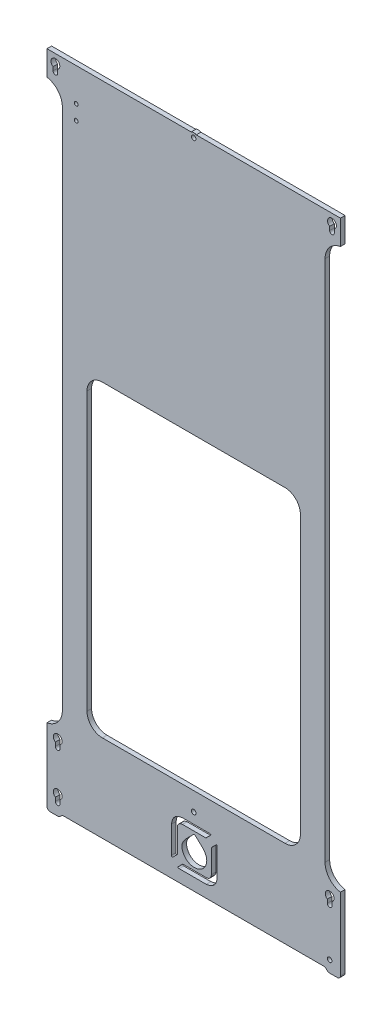
from build123d import *

# Parameters (mm, degrees)
SKETCH1_R           = 1.5
BOSS_EXTRUDE1_DEPTH = 3
SKETCH2_W           = 10
SKETCH2_H           = 363
CUT_EXTRUDE1_DEPTH  = 401.99329533
FILLET1_R           = 12
SKETCH3_R           = 1.5
CUT_EXTRUDE2_DEPTH  = 401.99329533
SKETCH4_W           = 138.54
SKETCH4_H           = 200
CUT_EXTRUDE3_DEPTH  = 401.99329533
FILLET2_R           = 10
CUT_EXTRUDE6_DEPTH  = 401.99329533
BOSS_EXTRUDE2_DEPTH = 3
SKETCH9_R           = 1.25
CUT_EXTRUDE7_DEPTH  = 402.478982012
FILLET3_R           = 2


with BuildPart() as part:
    # Sketch1 → Boss-Extrude1 (new body)
    with BuildSketch(Plane.XY):
        Polygon((95.27, 389.5), (-95.27, 389.5), (-95.27, -36.5), (-95.27, -38.5), (-87.27, -38.5), (-85.27, -36.5), (85.27, -36.5), (87.27, -38.5), (95.27, -38.5), (95.27, -36.5), align=None)
        with Locations((88.27, -31)):
            Circle(SKETCH1_R, mode=Mode.SUBTRACT)
        with BuildLine():
            Line((-89.77, -31), (-89.77, -28.576675837))
            ThreePointArc((-89.77, -28.576675837), (-88.27, -23.303351674), (-86.77, -28.576675837))
            Line((-86.77, -28.576675837), (-86.77, -31))
            ThreePointArc((-86.77, -31), (-88.27, -32.5), (-89.77, -31))
        make_face(mode=Mode.SUBTRACT)
        with BuildLine():
            Line((-91.27, 379), (-91.27, 381.423324163))
            ThreePointArc((-91.27, 381.423324163), (-89.77, 386.696648326), (-88.27, 381.423324163))
            Line((-88.27, 381.423324163), (-88.27, 379))
            ThreePointArc((-88.27, 379), (-89.77, 377.5), (-91.27, 379))
        make_face(mode=Mode.SUBTRACT)
        with BuildLine():
            Line((-89.77, 0), (-89.77, 2.423324163))
            ThreePointArc((-89.77, 2.423324163), (-88.27, 7.696648326), (-86.77, 2.423324163))
            Line((-86.77, 2.423324163), (-86.77, 0))
            ThreePointArc((-86.77, 0), (-88.27, -1.5), (-89.77, 0))
        make_face(mode=Mode.SUBTRACT)
        with BuildLine():
            Line((86.77, 0), (86.77, 2.423324163))
            ThreePointArc((86.77, 2.423324163), (88.27, 7.696648326), (89.77, 2.423324163))
            Line((89.77, 2.423324163), (89.77, 0))
            ThreePointArc((89.77, 0), (88.27, -1.5), (86.77, 0))
        make_face(mode=Mode.SUBTRACT)
        with BuildLine():
            Line((88.27, 379), (88.27, 381.423324163))
            ThreePointArc((88.27, 381.423324163), (89.77, 386.696648326), (91.27, 381.423324163))
            Line((91.27, 381.423324163), (91.27, 379))
            ThreePointArc((91.27, 379), (89.77, 377.5), (88.27, 379))
        make_face(mode=Mode.SUBTRACT)
    extrude(amount=BOSS_EXTRUDE1_DEPTH)

    # Sketch2 → Cut-Extrude1 (cut, through all)
    with BuildSketch(Plane.XY.offset(3)):
        with Locations((-90.27, 192)):
            Rectangle(SKETCH2_W, SKETCH2_H)
        with Locations((90.27, 192)):
            Rectangle(SKETCH2_W, SKETCH2_H)
    extrude(amount=-CUT_EXTRUDE1_DEPTH, mode=Mode.SUBTRACT)

    # Fillet1
    # the kernel refuses this fillet: 12 mm, written as the material it adds along each edge
    with BuildSketch(Plane(origin=(85.27, 10.5, 3), x_dir=(0, 1, 0), z_dir=(0, 0, -1))) as fillet1_piece_1:
        with BuildLine():
            CenterArc((11.832159566, 12), FILLET1_R, 189.594068227, 80.405931773)
            Line((0, 10), (-0.236643191, 9.96))
            ThreePointArc((-0.236643191, 9.96), (-0.24, 5), (-0.24, 0))
            Line((-0.24, 0), (0, -0.24))
            Line((0, -0.24), (11.832159566, -0.24))
            Line((11.832159566, -0.24), (11.832159566, 0))
        make_face()
    extrude(amount=3)
    with BuildSketch(Plane(origin=(-85.27, 10.5, 3), x_dir=(-1, 0, 0), z_dir=(0, 0, -1)), Plane(origin=(85.27, 373.5, 3), x_dir=(1, 0, 0), z_dir=(0, 0, -1))) as fillet1_piece_2:
        with BuildLine():
            CenterArc((12, 11.832159566), FILLET1_R, 180, 80.405931773)
            Line((0, 11.832159566), (-0.24, 11.832159566))
            Line((-0.24, 11.832159566), (-0.24, 0))
            Line((-0.24, 0), (0, -0.24))
            ThreePointArc((0, -0.24), (5, -0.24), (9.96, -0.236643191))
            Line((9.96, -0.236643191), (10, 0))
        make_face()
    extrude(amount=3)
    with BuildSketch(Plane(origin=(-85.27, 373.5, 3), x_dir=(-1, 0, 0), z_dir=(0, 0, -1))) as fillet1_piece_3:
        with BuildLine():
            CenterArc((12, -11.832159566), FILLET1_R, 99.594068227, 80.405931773)
            Line((0, -11.832159566), (-0.24, -11.832159566))
            Line((-0.24, -11.832159566), (-0.24, 0))
            Line((-0.24, 0), (0, 0.24))
            ThreePointArc((0, 0.24), (5, 0.24), (9.96, 0.236643191))
            Line((9.96, 0.236643191), (10, 0))
        make_face()
    extrude(amount=3)

    # Sketch3 → Cut-Extrude2 (cut, through all)
    with BuildSketch(Plane.XY.offset(3)):
        with Locations((0, 8)):
            Circle(SKETCH3_R)
        with Locations((0, 387)):
            Circle(SKETCH3_R)
    extrude(amount=-CUT_EXTRUDE2_DEPTH, mode=Mode.SUBTRACT)

    # Sketch4 → Cut-Extrude3 (cut, through all)
    with BuildSketch(Plane.XY.offset(3)):
        with Locations((0, 120)):
            Rectangle(SKETCH4_W, SKETCH4_H)
    extrude(amount=-CUT_EXTRUDE3_DEPTH, mode=Mode.SUBTRACT)

    # Fillet2
    fillet2_edges = [part.edges().sort_by_distance(p)[0] for p in [
        (69.27, 220, 1.5),
        (69.27, 20, 1.5),
        (-69.27, 20, 1.5),
        (-69.27, 220, 1.5),
    ]]
    fillet(fillet2_edges, radius=FILLET2_R)

    # Sketch7 → Cut-Extrude6 (cut, through all)
    with BuildSketch(Plane.XY.offset(3)):
        with BuildLine():
            Line((0, -4.625747067), (-4.853446, -9.478911067))
            add(Edge.make_bspline(
                [(-4.853446, -9.478911067), (-4.857912351, -9.483081634), (-4.866656945, -9.491247116), (-4.879059302, -9.503713001), (-5.337538841, -10.010036555), (-6.230966435, -11.055373417), (-7.331192138, -12.859816706), (-7.888732766, -15.68247692), (-6.848251753, -19.219926816), (-3.87827619, -22.168921175), (0.257731389, -23.442729161), (4.556872717, -22.384536362), (7.711761661, -19.214884535), (8.721669996, -15.693361765), (8.210921716, -12.898452929), (7.297062, -11.024788806), (6.42340495, -9.982340385), (6.00149, -9.478911067)],
                knots=[0, 0, 0, 0, 0.00048905, 0.000957504, 0.001406767, 0.055150507, 0.111017642, 0.168412939, 0.28062072, 0.389776696, 0.490762396, 0.614386559, 0.723193993, 0.835330316, 0.891393178, 0.947550538, 1, 1, 1, 1], degree=3))
            Line((6.00149, -9.478911067), (0.85164, -4.625747067))
            add(Edge.make_bspline(
                [(0.85164, -4.625747067), (0.812504777, -4.591871198), (0.735157355, -4.524918441), (0.595429053, -4.455653648), (0.494352228, -4.445831945), (0.443865, -4.440926067)],
                knots=[0, 0, 0, 0, 0.338885039, 0.6697773, 1, 1, 1, 1], degree=3))
            add(Edge.make_bspline(
                [(0.443865, -4.440926067), (0.391231255, -4.446012435), (0.28283653, -4.456487378), (0.128603807, -4.520285983), (0.042643095, -4.590777752), (0, -4.625747067)],
                knots=[0, 0, 0, 0, 0.322338023, 0.663827768, 1, 1, 1, 1], degree=3))
        make_face()
        with BuildLine():
            Line((-7.262249, -2.659011067), (7.816498, -2.659011067))
            add(Edge.make_bspline(
                [(7.816498, -2.659011067), (7.838633855, -2.657336087), (7.882028547, -2.65405249), (7.947196989, -2.646372498), (7.996383548, -2.620362599), (8.032363529, -2.594906582), (8.055666343, -2.571516128), (8.069966408, -2.556399534), (8.076952, -2.549015067)],
                knots=[0, 0, 0, 0, 0.227492727, 0.445972237, 0.663373124, 0.787115425, 0.896005733, 1, 1, 1, 1], degree=3))
            Line((8.076952, -2.549015067), (11.003915, 0.378054933))
            add(Edge.make_bspline(
                [(11.003915, 0.378054933), (11.032885577, 0.41734366), (11.090893613, 0.496011818), (11.114913005, 0.644204092), (11.087674239, 0.780129011), (11.020364912, 0.889633627), (10.92990422, 0.968536053), (10.796928563, 1.01792021), (10.636792988, 1.050210977), (10.451685735, 1.083522236), (10.32133885, 1.080968327), (10.250022702, 1.082486552), (10.237655163, 1.083110917), (10.229422255, 1.08252663), (10.225298, 1.082233933)],
                knots=[0, 0, 0, 0, 0.104345134, 0.208931166, 0.313565445, 0.39799532, 0.482811187, 0.567894079, 0.701186565, 0.836715425, 0.973246641, 0.982162759, 0.991064478, 1, 1, 1, 1], degree=3))
            Line((10.225298, 1.082233933), (-7.262249, 1.082233933))
            add(Edge.make_bspline(
                [(-7.262249, 1.082233933), (-8.511129945, 0.882704137), (-10.977178654, 0.488711261), (-13.817730251, -2.351779173), (-14.21170736, -4.818130973), (-14.411251, -6.067302067)],
                knots=[0, 0, 0, 0, 0.336153842, 0.663771636, 1, 1, 1, 1], degree=3))
            Line((-14.411251, -6.067302067), (-14.40984, -23.554462067))
            add(Edge.make_bspline(
                [(-14.40984, -23.554462067), (-14.410134083, -23.558443624), (-14.410714991, -23.566308487), (-14.410090067, -23.578170033), (-14.408523372, -23.649375149), (-14.411561941, -23.779959256), (-14.377772815, -23.965453953), (-14.347980077, -24.12632377), (-14.296470565, -24.258389655), (-14.217812969, -24.34867487), (-14.108625863, -24.416680752), (-13.972384561, -24.443941052), (-13.823855183, -24.419605944), (-13.745068287, -24.360891738), (-13.705662, -24.331525067)],
                knots=[0, 0, 0, 0, 0.008621864, 0.017030969, 0.025643238, 0.162638148, 0.298245388, 0.431901383, 0.516391776, 0.601007159, 0.685956809, 0.790142009, 0.895036806, 1, 1, 1, 1], degree=3))
            Line((-13.705662, -24.331525067), (-10.780079, -21.404598067))
            add(Edge.make_bspline(
                [(-10.780079, -21.404598067), (-10.771134268, -21.395334769), (-10.753581449, -21.37715681), (-10.726383877, -21.35014834), (-10.697695505, -21.314597849), (-10.677763559, -21.265504338), (-10.668178972, -21.20624608), (-10.668456591, -21.166390577), (-10.668601, -21.145659067)],
                knots=[0, 0, 0, 0, 0.131285455, 0.257629811, 0.390972346, 0.594165008, 0.788898108, 1, 1, 1, 1], degree=3))
            Line((-10.668601, -21.145659067), (-10.670012, -6.067302067))
            add(Edge.make_bspline(
                [(-10.670012, -6.067302067), (-10.581781089, -5.463366518), (-10.409341504, -4.283027408), (-9.04735205, -2.919969892), (-7.866579128, -2.747356264), (-7.262249, -2.659011067)],
                knots=[0, 0, 0, 0, 0.338409749, 0.6613922, 1, 1, 1, 1], degree=3))
        make_face()
        with BuildLine():
            Line((8.113889, -24.854096067), (-6.964468, -24.854096067))
            add(Edge.make_bspline(
                [(-6.964468, -24.854096067), (-6.983590791, -24.854827266), (-7.018737512, -24.856171173), (-7.072701098, -24.864605808), (-7.117000908, -24.884951669), (-7.156983989, -24.908696277), (-7.191465987, -24.934712687), (-7.213446707, -24.954986905), (-7.224925, -24.965574067)],
                knots=[0, 0, 0, 0, 0.196745559, 0.361608386, 0.557261599, 0.692766378, 0.839563136, 1, 1, 1, 1], degree=3))
            Line((-7.224925, -24.965574067), (-10.151886, -27.892526067))
            add(Edge.make_bspline(
                [(-10.151886, -27.892526067), (-10.180857353, -27.931834355), (-10.238850218, -28.010518985), (-10.262873283, -28.158684703), (-10.235694975, -28.294671316), (-10.168067382, -28.404104287), (-10.077659309, -28.482764753), (-9.945170887, -28.532717312), (-9.785065659, -28.56526856), (-9.600012365, -28.595539208), (-9.469461937, -28.601040572), (-9.398125359, -28.595822725), (-9.385664446, -28.596455901), (-9.377399042, -28.596623408), (-9.373271, -28.596707067)],
                knots=[0, 0, 0, 0, 0.104384754, 0.208950226, 0.313569176, 0.398093487, 0.483012464, 0.567612364, 0.700915154, 0.836484685, 0.973043492, 0.982112009, 0.991066088, 1, 1, 1, 1], degree=3))
            Line((-9.373271, -28.596707067), (8.113889, -28.596707067))
            add(Edge.make_bspline(
                [(8.113889, -28.596707067), (9.362902175, -28.39705422), (11.829318782, -28.002801294), (14.670409601, -25.161989582), (15.063970595, -22.695209824), (15.263284, -21.445944067)],
                knots=[0, 0, 0, 0, 0.336156644, 0.663805911, 1, 1, 1, 1], degree=3))
            Line((15.263284, -21.445944067), (15.261873, -3.960126067))
            add(Edge.make_bspline(
                [(15.261873, -3.960126067), (15.262165177, -3.95599181), (15.262750829, -3.947704952), (15.262123109, -3.935208369), (15.260639017, -3.863775454), (15.263180797, -3.73335511), (15.22980304, -3.548307751), (15.197969823, -3.388236673), (15.147963188, -3.255735572), (15.069373744, -3.16531901), (14.9599372, -3.097720575), (14.823912263, -3.070525492), (14.675444117, -3.094870647), (14.59696034, -3.153556576), (14.557691, -3.182920067)],
                knots=[0, 0, 0, 0, 0.008953482, 0.017946692, 0.027021307, 0.163490993, 0.298949058, 0.432165007, 0.516776033, 0.601601228, 0.686034701, 0.790672378, 0.895262972, 1, 1, 1, 1], degree=3))
            Line((14.557691, -3.182920067), (11.630765, -6.109884067))
            add(Edge.make_bspline(
                [(11.630765, -6.109884067), (11.621175557, -6.119082486), (11.602298416, -6.137189883), (11.573733515, -6.164993184), (11.543286048, -6.198235311), (11.526487636, -6.247686268), (11.521866647, -6.306249856), (11.521079531, -6.34710059), (11.520661, -6.368822067)],
                knots=[0, 0, 0, 0, 0.134581529, 0.264928249, 0.404990742, 0.58604785, 0.779890073, 1, 1, 1, 1], degree=3))
            Line((11.520661, -6.368822067), (11.52179, -21.445944067))
            add(Edge.make_bspline(
                [(11.52179, -21.445944067), (11.433856663, -22.050036898), (11.262002012, -23.230660386), (9.899167348, -24.593357882), (8.718300064, -24.765822413), (8.113889, -24.854096067)],
                knots=[0, 0, 0, 0, 0.33840601, 0.661371999, 1, 1, 1, 1], degree=3))
        make_face()
    extrude(amount=-CUT_EXTRUDE6_DEPTH, mode=Mode.SUBTRACT)

    # Sketch8 → Boss-Extrude2 (add)
    with BuildSketch(Plane.XY.offset(3)):
        with BuildLine():
            Line((-1.658312395, 389.5), (1.658312395, 389.5))
            ThreePointArc((1.658312395, 389.5), (0, 390), (-1.658312395, 389.5))
        make_face()
    extrude(amount=-BOSS_EXTRUDE2_DEPTH)

    # Sketch9 → Cut-Extrude7 (cut, through all)
    with BuildSketch(Plane.XY.offset(3)):
        with Locations((-76.27, 368)):
            Circle(SKETCH9_R)
        with Locations((-76.27, 358.5)):
            Circle(SKETCH9_R)
    extrude(amount=-CUT_EXTRUDE7_DEPTH, mode=Mode.SUBTRACT)

    # Fillet3
    fillet3_edges = [part.edges().sort_by_distance(p)[0] for p in [
        (95.27, -38.5, 1.5),
        (87.27, -38.5, 1.5),
        (85.27, -36.5, 1.5),
        (-85.27, -36.5, 1.5),
        (-87.27, -38.5, 1.5),
        (-95.27, -38.5, 1.5),
    ]]
    fillet(fillet3_edges, radius=FILLET3_R)


solid = part.part
